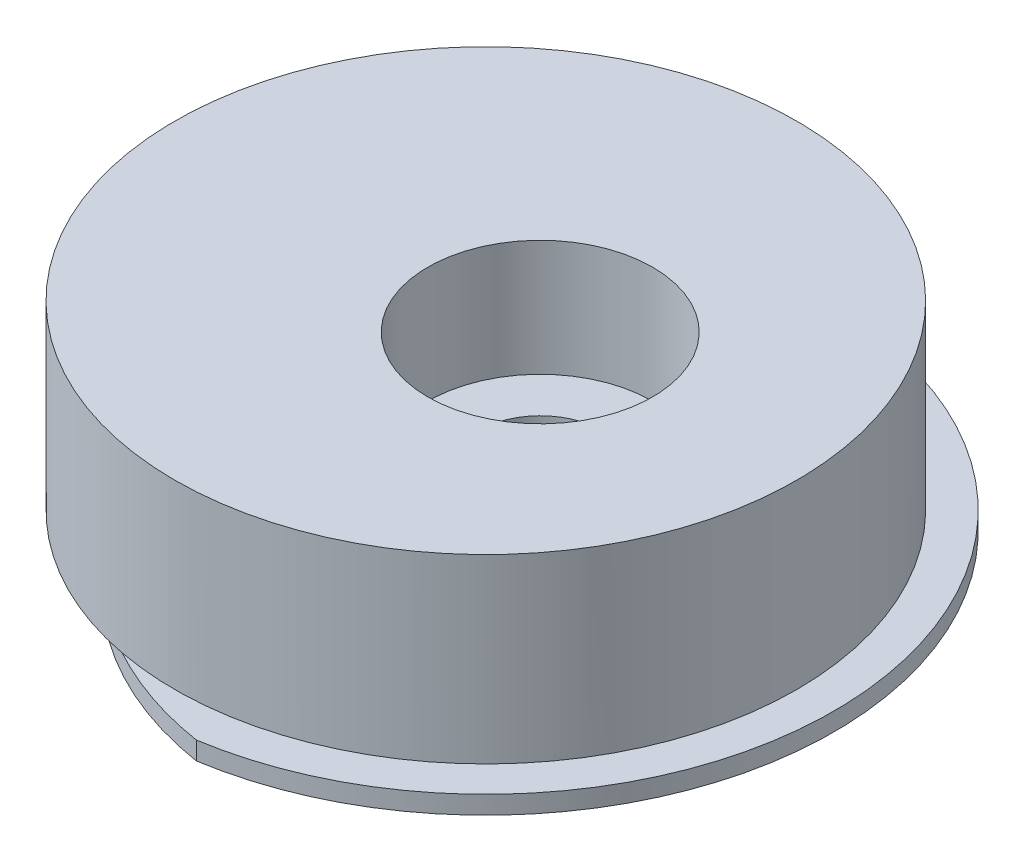
from build123d import *

# Parameters (mm, degrees)
BOSS_EXTRUDE1_DEPTH = 0.5
SKETCH2_R           = 8.575
BOSS_EXTRUDE2_DEPTH = 5
SKETCH3_R           = 1.65
SKETCH3_R_2         = 1.35
CUT_EXTRUDE1_DEPTH  = 4
SKETCH4_R           = 1.7
CUT_EXTRUDE2_DEPTH  = 15.888439307
SKETCH5_R           = 3.1
CUT_EXTRUDE3_DEPTH  = 3.2


with BuildPart() as part:
    # Sketch1 → Boss-Extrude1 (new body)
    with BuildSketch(Plane(origin=(0, 0, 0), x_dir=(1, 0, 0), z_dir=(0, 1, 0))):
        with BuildLine():
            ThreePointArc((8.1, 0), (5.799315036, 6.235382907), (0, 9.482088378))
            ThreePointArc((0, 9.482088378), (-8.1, 0), (0, -9.482088378))
            ThreePointArc((0, -9.482088378), (5.799315036, -6.235382907), (8.1, 0))
        make_face()
    extrude(amount=BOSS_EXTRUDE1_DEPTH)

    # Sketch2 → Boss-Extrude2 (add)
    with BuildSketch(Plane(origin=(0, 0.5, 0), x_dir=(1, 0, 0), z_dir=(0, 1, 0))):
        with Locations((-1.5, 0)):
            Circle(SKETCH2_R)
    extrude(amount=BOSS_EXTRUDE2_DEPTH)

    # Sketch3 → Cut-Extrude1 (cut)
    with BuildSketch(Plane(origin=(0, 0, 0), x_dir=(1, 0, 0), z_dir=(0, 1, 0))):
        with Locations((0, 5.8)):
            Circle(SKETCH3_R)
        with Locations((0, -5.8)):
            Circle(SKETCH3_R_2)
    extrude(amount=CUT_EXTRUDE1_DEPTH, mode=Mode.SUBTRACT)

    # Sketch4 → Cut-Extrude2 (cut, through all)
    with BuildSketch(Plane(origin=(0, 5.5, 0), x_dir=(1, 0, 0), z_dir=(0, 1, 0))):
        Circle(SKETCH4_R)
    extrude(amount=-CUT_EXTRUDE2_DEPTH, mode=Mode.SUBTRACT)

    # Sketch5 → Cut-Extrude3 (cut)
    with BuildSketch(Plane(origin=(0, 5.5, 0), x_dir=(1, 0, 0), z_dir=(0, 1, 0))):
        Circle(SKETCH5_R)
    extrude(amount=-CUT_EXTRUDE3_DEPTH, mode=Mode.SUBTRACT)


solid = part.part
